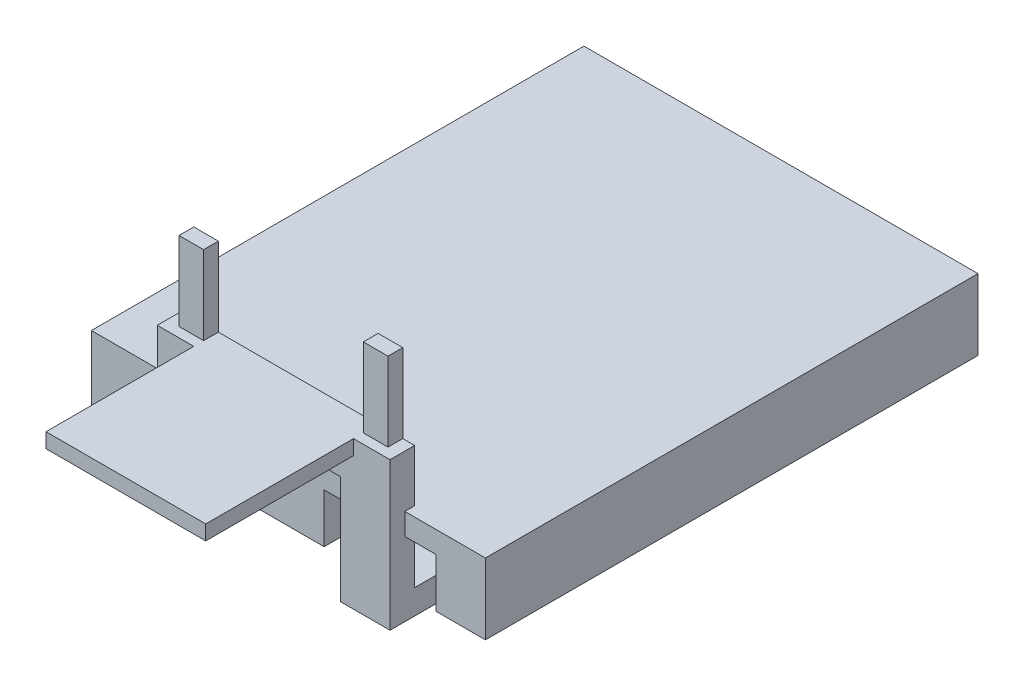
from build123d import *

# Parameters (mm, degrees)
Y_KSEKLIK_EKSTR_ZYON1_DEPTH   = 100
IZIM3_W                       = 10
IZIM3_H                       = 80
Y_KSEKLIK_EKSTR_ZYON4_DEPTH   = 5
Y_KSEKLIK_EKSTR_ZYON4_2_DEPTH = 5
IZIM5_W                       = 10
IZIM5_H                       = 5
Y_KSEKLIK_EKSTR_ZYON5_DEPTH   = 3
IZIM7_W                       = 10
IZIM7_H                       = 5
Y_KSEKLIK_EKSTR_ZYON6_DEPTH   = 25
RADYUS3_START                 = 596.88039773
RADYUS3_DEPTH                 = 10
RADYUS4_R                     = 50
IZIM8_W                       = 5
IZIM8_H                       = 8
Y_KSEKLIK_EKSTR_ZYON8_DEPTH   = 31
KES_EKSTR_ZYON3_DEPTH         = 15
Y_KSEKLIK_EKSTR_ZYON10_DEPTH  = 15
IZIM16_W                      = 32.429128763
IZIM16_H                      = 3
Y_KSEKLIK_EKSTR_ZYON12_DEPTH  = 50
IZIM17_W                      = 5
IZIM17_H                      = 3
Y_KSEKLIK_EKSTR_ZYON13_DEPTH  = 1
IZIM18_W                      = 32.429128763
IZIM18_H                      = 20
KES_EKSTR_ZYON4_DEPTH         = 10


with BuildPart() as part:
    # Çizim1 → Yükseklik-Ekstrüzyon1 (new body)
    with BuildSketch(Plane.XY):
        Polygon((580.50539773, 0), (590.50539773, 0), (590.50539773, 10), (613.25539773, 10), (613.25539773, 0), (627.75539773, 0), (627.75539773, 10), (650.50539773, 10), (650.50539773, 0), (660.50539773, 0), (660.50539773, 14.4), (580.50539773, 14.4), align=None)
    extrude(amount=Y_KSEKLIK_EKSTR_ZYON1_DEPTH)


with BuildPart() as body_2:
    # Çizim3 → Yükseklik-Ekstrüzyon4 (new body)
    with BuildSketch(Plane(origin=(0, 0, 0), x_dir=(-1, 0, 0), z_dir=(0, -1, 0))):
        with Locations((-601.88039773, -60)):
            Rectangle(IZIM3_W, IZIM3_H)
    extrude(amount=Y_KSEKLIK_EKSTR_ZYON4_DEPTH)



with BuildPart() as body_3:
    # Çizim3 → Y_kseklik-Ekstr_zyon4 2 (new body)
    with BuildSketch(Plane(origin=(0, 0, 0), x_dir=(-1, 0, 0), z_dir=(0, -1, 0))):
        with Locations((-639.13039773, -60)):
            Rectangle(IZIM3_W, IZIM3_H)
    extrude(amount=Y_KSEKLIK_EKSTR_ZYON4_2_DEPTH)


with BuildPart() as body_2_1:
    add(body_2.part)

    add(body_3.part)  # Yükseklik-Ekstrüzyon5 merges body 3
    # Çizim5 → Yükseklik-Ekstrüzyon5 (add)
    with BuildSketch(Plane.XY.offset(100)):
        with Locations((601.88039773, -2.5)):
            Rectangle(IZIM5_W, IZIM5_H)
        with Locations((639.13039773, -2.5)):
            Rectangle(IZIM5_W, IZIM5_H)
    extrude(amount=Y_KSEKLIK_EKSTR_ZYON5_DEPTH)

    # Çizim7 → Yükseklik-Ekstrüzyon6 (add)
    with BuildSketch(Plane(origin=(0, 0, 0), x_dir=(1, 0, 0), z_dir=(0, 1, 0))):
        with Locations((601.88039773, -100.5)):
            Rectangle(IZIM7_W, IZIM7_H)
        with Locations((639.13039773, -100.5)):
            Rectangle(IZIM7_W, IZIM7_H)
    extrude(amount=Y_KSEKLIK_EKSTR_ZYON6_DEPTH)

    # Radyus3: read off the stored shape, not the designer's step
    # Radyus3 outline → Radyus3 (cut)
    with BuildSketch(Plane.YZ.offset(RADYUS3_START)):
        with BuildLine():
            ThreePointArc((0, 41.794494718), (-1.266028276, 30.61415483), (-5, 20))
            Line((-5, 20), (0, 20))
            Line((0, 20), (0, 41.794494718))
        make_face()
    extrude(amount=RADYUS3_DEPTH, mode=Mode.SUBTRACT)

    # Radyus4
    # the kernel refuses this fillet: 50 mm, written as the material it takes off along each edge
    with BuildSketch(Plane(origin=(698.616634524, 0, 20), x_dir=(0, 0, 1), z_dir=(-1, 0, 0))) as radyus4_piece_1:
        with BuildLine():
            CenterArc((21.794494718, -50), RADYUS4_R, 90, 25.841932763)
            Line((0, -5), (-0.435889894, -4.1))
            ThreePointArc((-0.435889894, -4.1), (-1, -2.5), (-1, 0))
            Line((-1, 0), (0, 1))
            Line((0, 1), (21.794494718, 1))
            Line((21.794494718, 1), (21.794494718, 0))
        make_face()
    extrude(amount=118.972473589, mode=Mode.SUBTRACT)

    # Çizim8 → Yükseklik-Ekstrüzyon8 (add)
    with BuildSketch(Plane.ZY.offset(-634.13039773)):
        with Locations((100.5, 21)):
            Rectangle(IZIM8_W, IZIM8_H)
    extrude(amount=Y_KSEKLIK_EKSTR_ZYON8_DEPTH)

    # Çizim9 → Kes-Ekstrüzyon3 (cut)
    with BuildSketch(Plane(origin=(0, 25, 0), x_dir=(1, 0, 0), z_dir=(0, 1, 0))):
        Polygon((602.790833348, -98.75), (602.790833348, -98), (600.790833348, -98), (600.790833348, -98.858486155), (600.040833348, -98.858486155), (600.040833348, -100.358486155), (603.540833348, -100.358486155), (603.540833348, -98.75), align=None)
        Polygon((640.219962111, -98), (638.219962111, -98), (638.219962111, -98.75), (637.469962111, -98.75), (637.469962111, -100.358486155), (640.969962111, -100.358486155), (640.969962111, -98.858486155), (640.219962111, -98.858486155), align=None)
    extrude(amount=-KES_EKSTR_ZYON3_DEPTH, mode=Mode.SUBTRACT)

    # Çizim15 → Yükseklik-Ekstrüzyon10 (add)
    with BuildSketch(Plane(origin=(0, 25, 0), x_dir=(1, 0, 0), z_dir=(0, 1, 0))):
        Polygon((600.040833348, -98.858486155), (600.790833348, -98.858486155), (600.790833348, -98), (599.290833348, -98), (599.290833348, -101), (604.290833348, -101), (604.290833348, -98), (602.790833348, -98), (602.790833348, -98.75), (603.540833348, -98.75), (603.540833348, -100.358486155), (600.040833348, -100.358486155), align=None)
        Polygon((638.219962111, -98), (636.719962111, -98), (636.719962111, -101), (641.719962111, -101), (641.719962111, -98), (640.219962111, -98), (640.219962111, -98.858486155), (640.969962111, -98.858486155), (640.969962111, -100.358486155), (637.469962111, -100.358486155), (637.469962111, -98.75), (638.219962111, -98.75), align=None)
    extrude(amount=Y_KSEKLIK_EKSTR_ZYON10_DEPTH)

    # Çizim16 → Yükseklik-Ekstrüzyon12 (add)
    with BuildSketch(Plane.XY.offset(103)):
        with Locations((620.50539773, 23.5)):
            Rectangle(IZIM16_W, IZIM16_H)
    extrude(amount=Y_KSEKLIK_EKSTR_ZYON12_DEPTH)

    # Çizim17 → Yükseklik-Ekstrüzyon13 (add)
    with BuildSketch(Plane(origin=(0, 40, 0), x_dir=(1, 0, 0), z_dir=(0, 1, 0))):
        with Locations((639.219962111, -99.5)):
            Rectangle(IZIM17_W, IZIM17_H)
        with Locations((601.790833348, -99.5)):
            Rectangle(IZIM17_W, IZIM17_H)
    extrude(amount=Y_KSEKLIK_EKSTR_ZYON13_DEPTH)

    # Çizim18 → Kes-Ekstrüzyon4 (cut)
    with BuildSketch(Plane(origin=(0, 25, 0), x_dir=(1, 0, 0), z_dir=(0, 1, 0))):
        with Locations((620.50539773, -143)):
            Rectangle(IZIM18_W, IZIM18_H)
    extrude(amount=-KES_EKSTR_ZYON4_DEPTH, mode=Mode.SUBTRACT)


solid = Compound([part.part, body_2_1.part])
